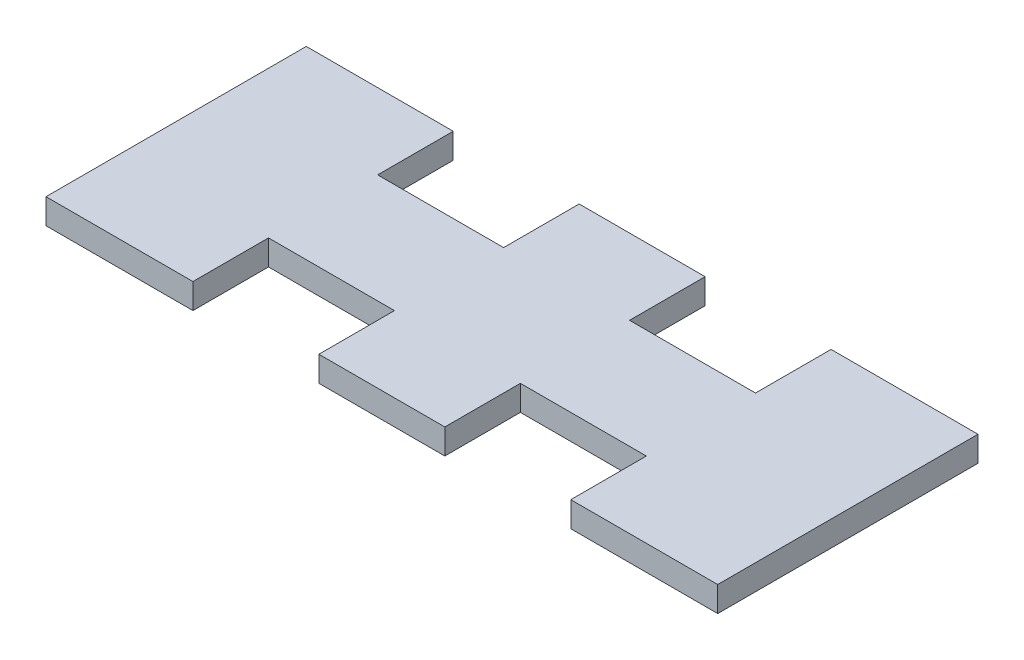
from build123d import *

# Parameters (mm, degrees)
SALIENTE_EXTRUIR1_DEPTH = 3


with BuildPart() as part:
    # Croquis1 → Saliente-Extruir1 (new body)
    with BuildSketch(Plane(origin=(0, 0, 0), x_dir=(1, 0, 0), z_dir=(0, 1, 0))):
        Polygon((0, 0), (17.5, 0), (17.5, 9), (32.5, 9), (32.5, 0), (47.5, 0), (47.5, 9), (62.5, 9), (62.5, 0), (80, 0), (80, 31), (62.5, 31), (62.5, 22), (47.5, 22), (47.5, 31), (32.5, 31), (32.5, 22), (17.5, 22), (17.5, 31), (0, 31), align=None)
    extrude(amount=SALIENTE_EXTRUIR1_DEPTH)


solid = part.part
